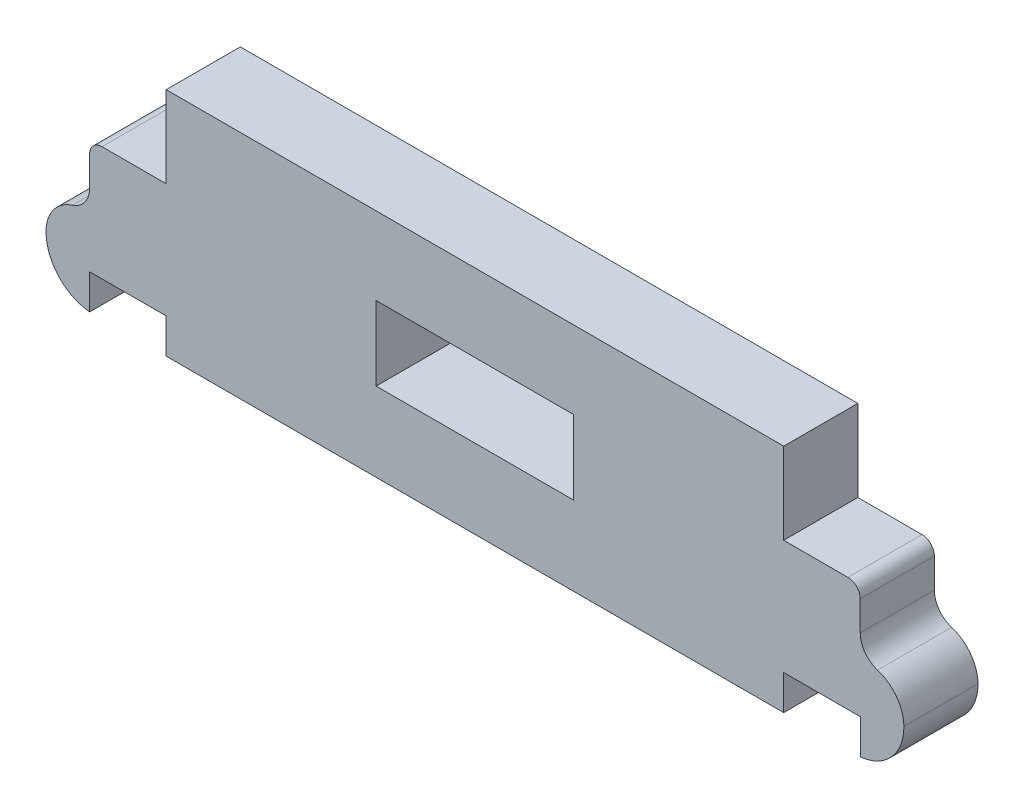
from build123d import *

# Parameters (mm, degrees)
ESQUISSE1_W               = 8
ESQUISSE1_H               = 3
T_LE_DE_BASE_PLI_E1_DEPTH = 3


# Sheet-metal steps are written as plain solids
with BuildPart() as part:
    # Esquisse1 → Tôle de base pliée1 (new body)
    with BuildSketch(Plane.XY):
        with BuildLine():
            Line((1127.943508916, 1917.30650062), (1152.943508916, 1917.30650062))
            Line((1152.943508916, 1917.30650062), (1152.943508916, 1914.00650062))
            Line((1152.943508916, 1914.00650062), (1155.54275991, 1914.00650062))
            ThreePointArc((1155.54275991, 1914.00650062), (1155.896313301, 1913.860054011), (1156.04275991, 1913.50650062))
            Line((1156.04275991, 1913.50650062), (1156.04275991, 1912.309090129))
            ThreePointArc((1156.04275991, 1912.309090129), (1156.236433485, 1911.717619339), (1156.742435301, 1911.355253073))
            ThreePointArc((1156.742435301, 1911.355253073), (1157.511445693, 1910.806601852), (1157.810195296, 1909.910418936))
            ThreePointArc((1157.810195296, 1909.910418936), (1157.306705477, 1908.592046054), (1156.043508916, 1907.962805635))
            Line((1156.043508916, 1907.962805635), (1156.043508916, 1909.371416958))
            Line((1156.043508916, 1909.371416958), (1152.943508916, 1909.371416958))
            Line((1152.943508916, 1909.371416958), (1152.943508916, 1907.962805635))
            Line((1152.943508916, 1907.962805635), (1127.943508916, 1907.962805635))
            Line((1127.943508916, 1907.962805635), (1127.943508916, 1909.371416958))
            Line((1127.943508916, 1909.371416958), (1124.843508916, 1909.371416958))
            Line((1124.843508916, 1909.371416958), (1124.843508916, 1907.962805635))
            ThreePointArc((1124.843508916, 1907.962805635), (1123.580312356, 1908.592046054), (1123.076822537, 1909.910418936))
            ThreePointArc((1123.076822537, 1909.910418936), (1123.37557214, 1910.806601852), (1124.144582531, 1911.355253073))
            ThreePointArc((1124.144582531, 1911.355253073), (1124.650584348, 1911.717619339), (1124.844257922, 1912.309090129))
            Line((1124.844257922, 1912.309090129), (1124.844257922, 1913.50650062))
            ThreePointArc((1124.844257922, 1913.50650062), (1124.990704532, 1913.860054011), (1125.344257922, 1914.00650062))
            Line((1125.344257922, 1914.00650062), (1127.943508916, 1914.00650062))
            Line((1127.943508916, 1914.00650062), (1127.943508916, 1917.30650062))
        make_face()
        with Locations((1140.443508916, 1912.662805635)):
            Rectangle(ESQUISSE1_W, ESQUISSE1_H, mode=Mode.SUBTRACT)
    extrude(amount=-T_LE_DE_BASE_PLI_E1_DEPTH)


solid = part.part
